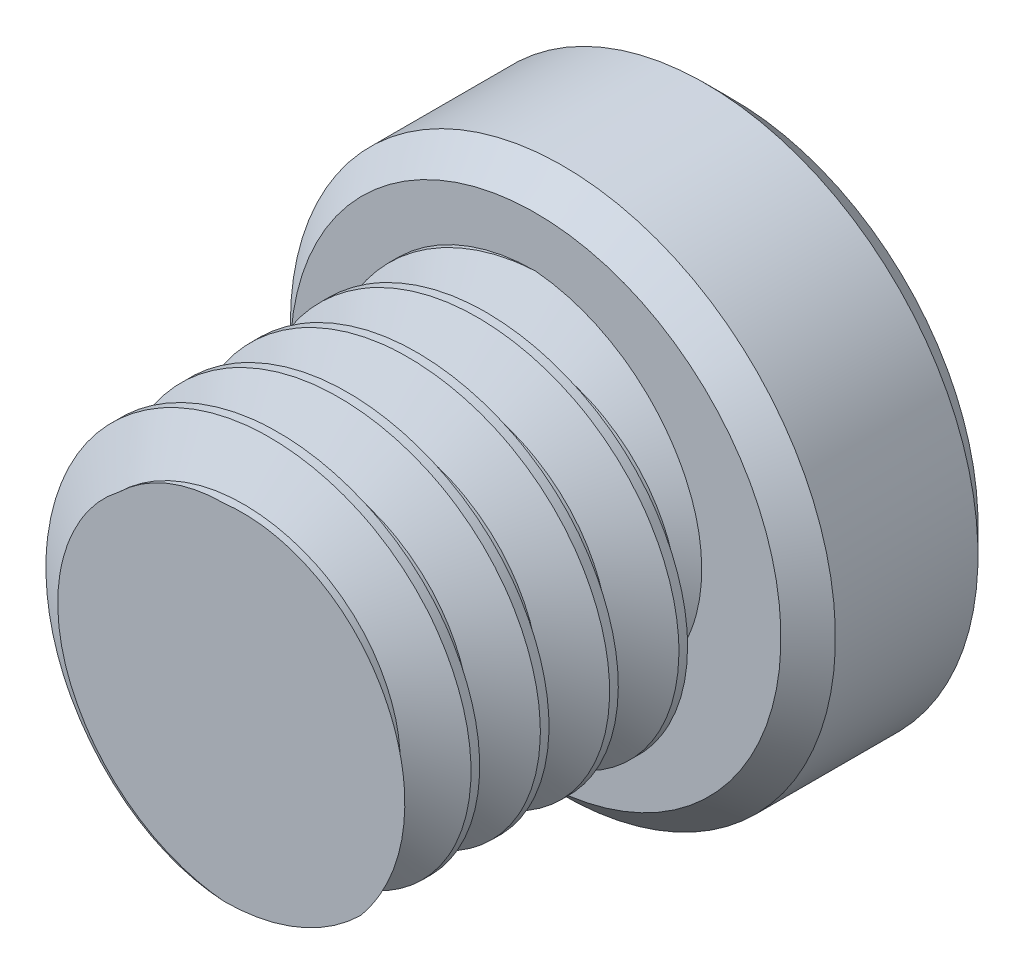
from build123d import *

# Parameters (mm, degrees)
SKETCH1_R          = 3.96875
EXTRUDE1_DEPTH     = 12.7
CUT_SWEEP1_PITCH   = 1.411111111
SKETCH6_R          = 5.5499
EXTRUDE2_DEPTH     = 4.0132
CUT_EXTRUDE1_DEPTH = 2.9765625
CHAMFER1_SIZE      = 0.55499
SKETCH12_R         = 7.001526365
CUT_EXTRUDE3_DEPTH = 6.35


with BuildPart() as part:
    # Sketch1 → Extrude1 (new body)
    with BuildSketch(Plane.XY):
        Circle(SKETCH1_R)
    extrude(amount=-EXTRUDE1_DEPTH)

    # Cut-Sweep1: the profile of Sketch3 profile screwed along a right-hand helix of 10 turns, 6 arcs to a turn; built about Z, then put on its axis
    cut_sweep1_z = Axis((0, 0, 0), (0, 0, 1))
    cut_sweep1_corners = [(3.96905, 0, -1.234895427), (3.052206448, 0, -0.705555556), (3.052206448, 0, -0.529166667), (3.96905, 0, 0.000173205)]
    with BuildLine(mode=Mode.PRIVATE) as cut_sweep1_profile:
        Line(cut_sweep1_corners[0], cut_sweep1_corners[1])
        Line(cut_sweep1_corners[1], cut_sweep1_corners[2])
        Line(cut_sweep1_corners[2], cut_sweep1_corners[3])
        Line(cut_sweep1_corners[3], cut_sweep1_corners[0])
    cut_sweep1_cap = Face(cut_sweep1_profile.wire())
    cut_sweep1_turn_angles = [0, 30, 60, 90, 120, 150, 180, 210, 240, 270, 300, 330, 360]
    cut_sweep1_turn_weights = [1, 0.8660254037844387, 1, 0.8660254037844387, 1, 0.8660254037844387, 1, 0.8660254037844387, 1, 0.8660254037844387, 1, 0.8660254037844387, 1]
    cut_sweep1_turn_rails = [Edge.make_bspline([Vector(p[0], p[1], 0).rotate(cut_sweep1_z, cut_sweep1_turn_angles[k]) / cut_sweep1_turn_weights[k] + Vector(0, 0, p[2] + CUT_SWEEP1_PITCH * cut_sweep1_turn_angles[k] / 360) for k in range(13)], [0, 0, 0, 1, 1, 2, 2, 3, 3, 4, 4, 5, 5, 6, 6, 6], 2, cut_sweep1_turn_weights) for p in cut_sweep1_corners]
    cut_sweep1_turn_sides = [Face.make_surface_from_curves(cut_sweep1_turn_rails[p[0]], cut_sweep1_turn_rails[p[1]]) for p in [(0, 1), (1, 2), (2, 3), (3, 0)]]
    cut_sweep1 = Plane(origin=(0, 0, 0), x_dir=(0, 1, 0), z_dir=(0, 0, -1)) * Solid(Shell([*[p.moved(Location((0, 0, CUT_SWEEP1_PITCH * i))) for i in range(10) for p in cut_sweep1_turn_sides], cut_sweep1_cap, cut_sweep1_cap.rotate(cut_sweep1_z, 3600).moved(Location((0, 0, CUT_SWEEP1_PITCH * 3600 / 360)))]))
    add(cut_sweep1, mode=Mode.SUBTRACT)

    # Sketch4 → Cut-Revolve1 (revolve, cut)
    with BuildSketch(Plane(origin=(0, 0, 0), x_dir=(0, 0, -1), z_dir=(1, 0, 0)), mode=Mode.PRIVATE) as cut_revolve1_sk:
        Polygon((0.819623419, 3.96875), (0, 2.798206448), (0, 3.96875), align=None)
    revolve(cut_revolve1_sk.sketch.rotate(Axis((0, 0, 0), (0, 0, -1)), 224.846133378), axis=Axis((0, 0, 0), (0, 0, -1)), mode=Mode.SUBTRACT)

    # Sketch6 → Extrude2 (add)
    with BuildSketch(Plane(origin=(0, 0, -12.7), x_dir=(-1, 0, 0), z_dir=(0, 0, -1))):
        Circle(SKETCH6_R)
    extrude(amount=EXTRUDE2_DEPTH)

    # Sketch7 → Cut-Extrude1 (cut)
    with BuildSketch(Plane(origin=(0, 0, -16.7132), x_dir=(-1, 0, 0), z_dir=(0, 0, -1))):
        Polygon((0, 2.291358881), (-1.984375, 1.14567944), (-1.984375, -1.14567944), (0, -2.291358881), (1.984375, -1.14567944), (1.984375, 1.14567944), align=None)
    extrude(amount=-CUT_EXTRUDE1_DEPTH, mode=Mode.SUBTRACT)

    # Cut-Extrude2 cone 1 section (through the dimple's axis) → Cut-Extrude2 (revolve, cut)
    with BuildSketch(Plane(origin=(0, 0, -16.7132), x_dir=(0, 1, 0), z_dir=(1, 0, 0))):
        Polygon((0, 0), (2.291358881, 0), (0, 2.291358881), align=None)
    revolve(axis=Axis((0, 0, -16.7132), (0, 0, 1)), mode=Mode.SUBTRACT)

    # Chamfer1
    chamfer1_edges = [part.edges().sort_by_distance(p)[0] for p in [
        (5.5499, 0, -12.7),
        (5.5499, 0, -16.7132),
    ]]
    chamfer(chamfer1_edges, length=CHAMFER1_SIZE)

    # Sketch12 → Cut-Extrude3 (cut)
    with BuildSketch(Plane.XY):
        Circle(SKETCH12_R)
    extrude(amount=-CUT_EXTRUDE3_DEPTH, mode=Mode.SUBTRACT)


solid = part.part
